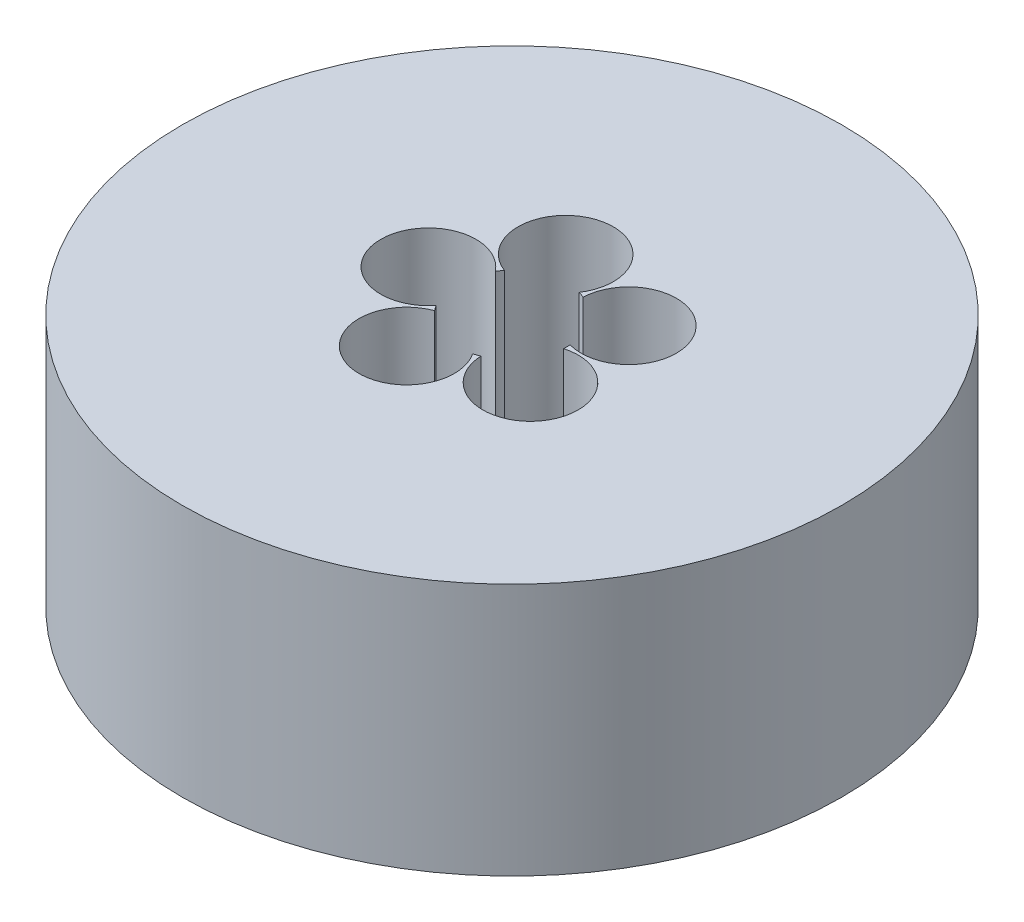
from build123d import *

# Parameters (mm, degrees)
SKETCH1_R           = 30
BOSS_EXTRUDE1_DEPTH = 23
SKETCH2_R           = 5
CUT_EXTRUDE1_DEPTH  = 49.259714048
SKETCH3_R           = 4.33494273
CUT_EXTRUDE2_DEPTH  = 20.034648303
CIRPATTERN1_COUNT   = 5


with BuildPart() as part:
    # Sketch1 → Boss-Extrude1 (new body)
    with BuildSketch(Plane(origin=(0, 0, 0), x_dir=(1, 0, 0), z_dir=(0, 1, 0))):
        Circle(SKETCH1_R)
    extrude(amount=BOSS_EXTRUDE1_DEPTH)

    # Sketch2 → Cut-Extrude1 (cut, through all)
    with BuildSketch(Plane(origin=(0, 0, 0), x_dir=(1, 0, 0), z_dir=(0, 1, 0))):
        Circle(SKETCH2_R)
    extrude(amount=CUT_EXTRUDE1_DEPTH, mode=Mode.SUBTRACT)

    # Sketch3 → Cut-Extrude2 (cut)
    with BuildSketch(Plane(origin=(0, 23, 0), x_dir=(1, 0, 0), z_dir=(0, 1, 0))):
        with Locations((-7.606714675, 0)):
            Circle(SKETCH3_R)
    cut_extrude2 = extrude(amount=-CUT_EXTRUDE2_DEPTH, mode=Mode.SUBTRACT)

    # CirPattern1: Cut-Extrude2 ×5 about axis
    cirpattern1_axis = Axis((0, 0, 0), (0, 1, 0))
    for i in range(1, CIRPATTERN1_COUNT):
        add(cut_extrude2.rotate(cirpattern1_axis, i * 360 / CIRPATTERN1_COUNT), mode=Mode.SUBTRACT)


solid = part.part
